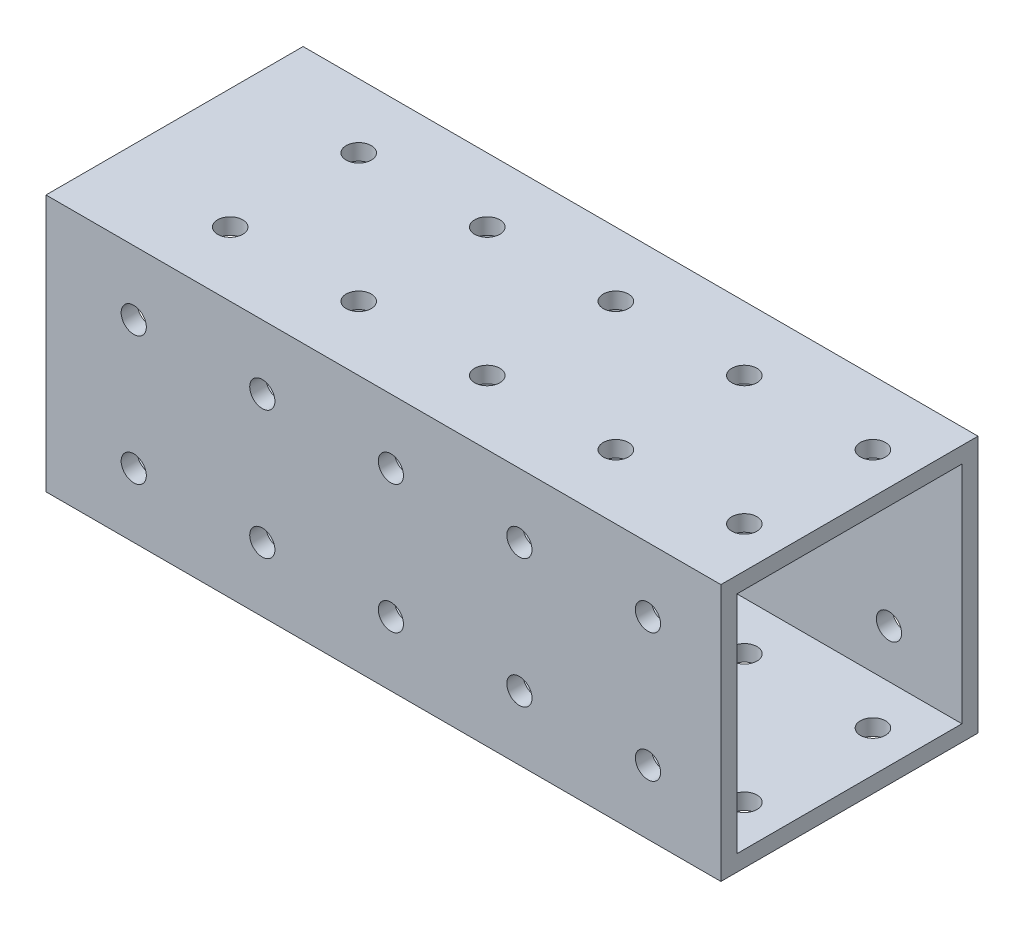
from build123d import *

# Parameters (mm, degrees)
SKETCH1_W           = 50.8
SKETCH1_H           = 50.8
BOSS_EXTRUDE1_DEPTH = 133.35
SHELL1_T            = -3.175
SKETCH2_R           = 2.4892
CUT_EXTRUDE1_DEPTH  = 152.471127612
SKETCH3_R           = 2.4892
CUT_EXTRUDE2_DEPTH  = 152.471127612
LPATTERN1_COUNT     = 5
LPATTERN1_PITCH     = 25.4


with BuildPart() as part:
    # Sketch1 → Boss-Extrude1 (new body)
    with BuildSketch(Plane(origin=(0, 0, 0), x_dir=(0, 0, -1), z_dir=(1, 0, 0))):
        with Locations((25.4, 25.4)):
            Rectangle(SKETCH1_W, SKETCH1_H)
    extrude(amount=BOSS_EXTRUDE1_DEPTH)

    # Shell1
    shell1_openings = [part.faces().sort_by_distance(p)[0] for p in [
        (0, 25.4, -25.4),
        (133.35, 25.4, -25.4),
    ]]
    offset(amount=SHELL1_T, openings=shell1_openings, kind=Kind.INTERSECTION)

    # Sketch2 → Cut-Extrude1 (cut, through all)
    with BuildSketch(Plane(origin=(0, 0, -50.8), x_dir=(-1, 0, 0), z_dir=(0, 0, -1))):
        with Locations((-118.938330442, 38.1)):
            Circle(SKETCH2_R)
        with Locations((-93.538330442, 38.1)):
            Circle(SKETCH2_R)
        with Locations((-68.138330442, 38.1)):
            Circle(SKETCH2_R)
        with Locations((-42.738330442, 38.1)):
            Circle(SKETCH2_R)
        with Locations((-17.338330442, 38.1)):
            Circle(SKETCH2_R)
        with Locations((-17.338330442, 12.7)):
            Circle(SKETCH2_R)
        with Locations((-42.738330442, 12.7)):
            Circle(SKETCH2_R)
        with Locations((-68.138330442, 12.7)):
            Circle(SKETCH2_R)
        with Locations((-93.538330442, 12.7)):
            Circle(SKETCH2_R)
        with Locations((-118.938330442, 12.7)):
            Circle(SKETCH2_R)
    extrude(amount=-CUT_EXTRUDE1_DEPTH, mode=Mode.SUBTRACT)

    # Sketch3 → Cut-Extrude2 (cut, through all)
    with BuildSketch(Plane.XZ):
        with Locations((125.288330442, -12.7)):
            Circle(SKETCH3_R)
        with Locations((125.288330442, -38.1)):
            Circle(SKETCH3_R)
    cut_extrude2 = extrude(amount=-CUT_EXTRUDE2_DEPTH, mode=Mode.SUBTRACT)

    # LPattern1: Cut-Extrude2 ×5
    with Locations(*[(-i * LPATTERN1_PITCH, 0, 0) for i in range(1, LPATTERN1_COUNT)]):
        add(cut_extrude2, mode=Mode.SUBTRACT)


solid = part.part
